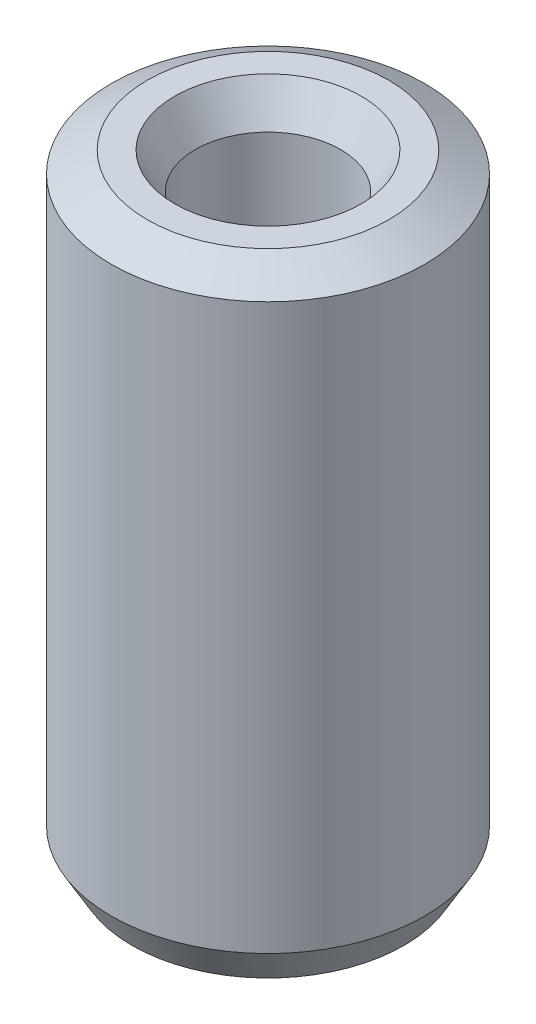
from build123d import *
from OCP.BRepFilletAPI import BRepFilletAPI_MakeChamfer

# Parameters (mm, degrees)
SKETCH1_R           = 22.5
BOSS_EXTRUDE1_DEPTH = 89.191342687
SKETCH2_R           = 10.431901259
CUT_EXTRUDE1_DEPTH  = 95.69738967
CHAMFER1_SIZE       = 2.972787552
CHAMFER1_SIZE2      = 5.14901908


with BuildPart() as part:
    # Sketch1 → Boss-Extrude1 (new body)
    with BuildSketch(Plane(origin=(0, 0, 0), x_dir=(1, 0, 0), z_dir=(0, 1, 0))):
        Circle(SKETCH1_R)
    extrude(amount=BOSS_EXTRUDE1_DEPTH)

    # Sketch2 → Cut-Extrude1 (cut, through all)
    with BuildSketch(Plane(origin=(0, 0, 0), x_dir=(1, 0, 0), z_dir=(0, 1, 0))):
        Circle(SKETCH2_R)
    extrude(amount=CUT_EXTRUDE1_DEPTH, mode=Mode.SUBTRACT)

    # Chamfer1: one chamfer whose edges measure the first distance from different faces: ONE call of the kernel's chamfer builder (chamfer() names one face for all edges)
    chamfer1_edges_1 = [part.edges().sort_by_distance(p)[0] for p in [
        (-10.431901259, 89.191342687, 0),
    ]]
    chamfer1_side_1 = [part.faces().sort_by_distance(p)[0] for p in [
        (-21.863603897, 89.191342687, 0),
    ]]
    chamfer1_edges_2 = [part.edges().sort_by_distance(p)[0] for p in [
        (-10.431901259, 0, 0),
    ]]
    chamfer1_side_2 = [part.faces().sort_by_distance(p)[0] for p in [
        (-10.431901259, 44.595671344, 0),
    ]]
    chamfer1_edges_3 = [part.edges().sort_by_distance(p)[0] for p in [
        (-22.5, 0, 0),
    ]]
    chamfer1_side_3 = [part.faces().sort_by_distance(p)[0] for p in [
        (-21.863603897, 0, 0),
    ]]
    chamfer1_edges_4 = [part.edges().sort_by_distance(p)[0] for p in [
        (-22.5, 89.191342687, 0),
    ]]
    chamfer1_side_4 = [part.faces().sort_by_distance(p)[0] for p in [
        (-22.5, 44.595671344, 0),
    ]]
    chamfer1 = BRepFilletAPI_MakeChamfer(part.part.solid().wrapped)
    for e in chamfer1_edges_1:
        chamfer1.Add(CHAMFER1_SIZE, CHAMFER1_SIZE2, e.wrapped, chamfer1_side_1[0].wrapped)  # the first distance lies on this face
    for e in chamfer1_edges_2:
        chamfer1.Add(CHAMFER1_SIZE, CHAMFER1_SIZE2, e.wrapped, chamfer1_side_2[0].wrapped)  # the first distance lies on this face
    for e in chamfer1_edges_3:
        chamfer1.Add(CHAMFER1_SIZE, CHAMFER1_SIZE2, e.wrapped, chamfer1_side_3[0].wrapped)  # the first distance lies on this face
    for e in chamfer1_edges_4:
        chamfer1.Add(CHAMFER1_SIZE, CHAMFER1_SIZE2, e.wrapped, chamfer1_side_4[0].wrapped)  # the first distance lies on this face
    add(Compound.cast(chamfer1.Shape()), mode=Mode.REPLACE)


solid = part.part
